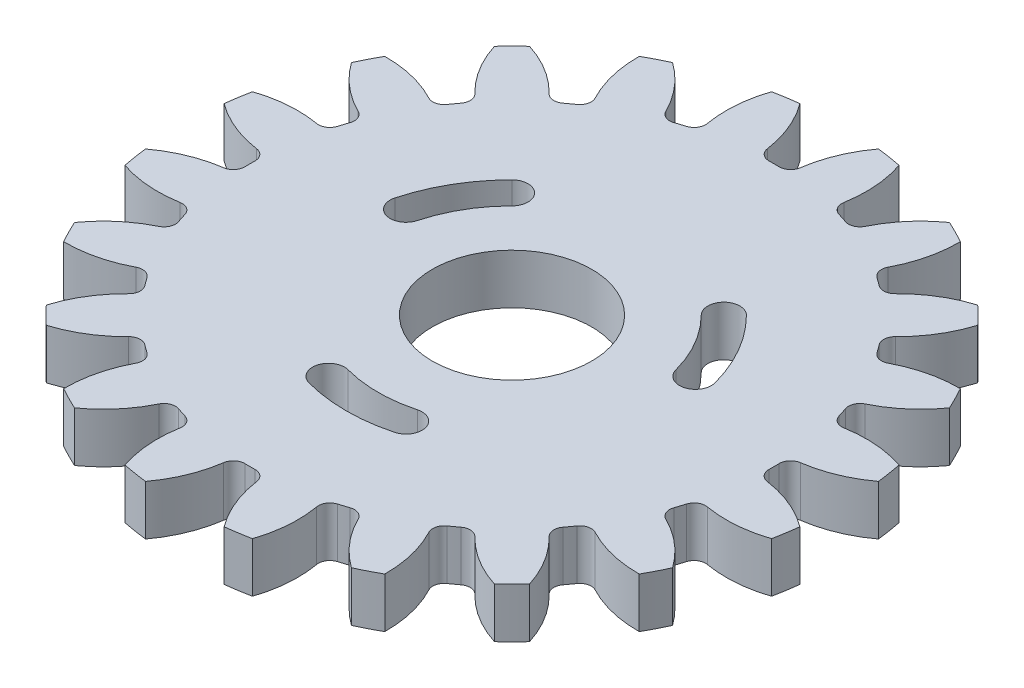
from build123d import *

# Parameters (mm, degrees)
SKETCH2_R                = 33
SKETCH2_R_2              = 7.975
BOSS_EXTRUDE1_DEPTH      = 5
CUT_EXTRUDE1_DEPTH       = 47.936126811
FILLET1_R                = 1.14
CIRPATTERN1_COUNT        = 20
FILLET1_OF_CIRPATTERN1_R = 1.14
CUT_EXTRUDE2_DEPTH       = 47.605335236


with BuildPart() as part:
    # Sketch2 → Boss-Extrude1 (new body)
    with BuildSketch(Plane(origin=(0, 0, 0), x_dir=(1, 0, 0), z_dir=(0, 1, 0))):
        Circle(SKETCH2_R)
        Circle(SKETCH2_R_2, mode=Mode.SUBTRACT)
    extrude(amount=BOSS_EXTRUDE1_DEPTH)

    # Sketch3 → Cut-Extrude1 (cut, through all)
    with BuildSketch(Plane(origin=(0, 5, 0), x_dir=(1, 0, 0), z_dir=(0, 1, 0))):
        with BuildLine():
            ThreePointArc((1.54561618, 26.204457076), (0, 26.25), (-1.54561618, 26.204457076))
            ThreePointArc((-1.54561618, 26.204457076), (-2.260255479, 29.659029471), (-3.933366347, 32.764746744))
            ThreePointArc((-3.933366347, 32.764746744), (0, 33), (3.933366347, 32.764746744))
            ThreePointArc((3.933366347, 32.764746744), (2.260255479, 29.659029471), (1.54561618, 26.204457076))
        make_face()
    cut_extrude1 = extrude(amount=-CUT_EXTRUDE1_DEPTH, mode=Mode.SUBTRACT)

    # Fillet1
    fillet1_edges = [part.edges().sort_by_distance(p)[0] for p in [
        (1.54561618, 2.5, -26.204457076),
        (-1.54561618, 2.5, -26.204457076),
    ]]
    fillet(fillet1_edges, radius=FILLET1_R)

    # CirPattern1: Cut-Extrude1 ×20 about axis
    cirpattern1_axis = Axis((0, 5, 0), (0, -1, 0))
    for i in range(1, CIRPATTERN1_COUNT):
        add(cut_extrude1.rotate(cirpattern1_axis, i * 360 / CIRPATTERN1_COUNT), mode=Mode.SUBTRACT)

    # Fillet1 of CirPattern1
    fillet1_of_cirpattern1_edges = [part.edges().sort_by_distance(p)[0] for p in [
        (9.567590904, 2.5, -24.444297991),
        (6.627654225, 2.5, -25.399541324),
        (16.65302317, 2.5, -20.291360706),
        (14.152163657, 2.5, -22.108341499),
        (22.108341499, 2.5, -14.152163657),
        (20.291360706, 2.5, -16.65302317),
        (25.399541324, 2.5, -6.627654225),
        (24.444297991, 2.5, -9.567590904),
        (26.204457076, 2.5, 1.54561618),
        (26.204457076, 2.5, -1.54561618),
        (24.444297991, 2.5, 9.567590904),
        (25.399541324, 2.5, 6.627654225),
        (20.291360706, 2.5, 16.65302317),
        (22.108341499, 2.5, 14.152163657),
        (14.152163657, 2.5, 22.108341499),
        (16.65302317, 2.5, 20.291360706),
        (6.627654225, 2.5, 25.399541324),
        (9.567590904, 2.5, 24.444297991),
        (-1.54561618, 2.5, 26.204457076),
        (1.54561618, 2.5, 26.204457076),
        (-9.567590904, 2.5, 24.444297991),
        (-6.627654225, 2.5, 25.399541324),
        (-16.65302317, 2.5, 20.291360706),
        (-14.152163657, 2.5, 22.108341499),
        (-22.108341499, 2.5, 14.152163657),
        (-20.291360706, 2.5, 16.65302317),
        (-25.399541324, 2.5, 6.627654225),
        (-24.444297991, 2.5, 9.567590904),
        (-26.204457076, 2.5, -1.54561618),
        (-26.204457076, 2.5, 1.54561618),
        (-24.444297991, 2.5, -9.567590904),
        (-25.399541324, 2.5, -6.627654225),
        (-20.291360706, 2.5, -16.65302317),
        (-22.108341499, 2.5, -14.152163657),
        (-14.152163657, 2.5, -22.108341499),
        (-16.65302317, 2.5, -20.291360706),
        (-6.627654225, 2.5, -25.399541324),
        (-9.567590904, 2.5, -24.444297991),
    ]]
    fillet(fillet1_of_cirpattern1_edges, radius=FILLET1_OF_CIRPATTERN1_R)

    # Sketch4 → Cut-Extrude2 (cut, through all)
    with BuildSketch(Plane.XZ):
        with BuildLine():
            ThreePointArc((4.296396149, 16.034368716), (0, 16.6), (-4.296396149, 16.034368716))
            ThreePointArc((-4.296396149, 16.034368716), (-5.427766999, 14.074776922), (-3.468175204, 12.943406072))
            ThreePointArc((-3.468175204, 12.943406072), (0, 13.4), (3.468175204, 12.943406072))
            ThreePointArc((3.468175204, 12.943406072), (5.427766999, 14.074776922), (4.296396149, 16.034368716))
        make_face()
        with BuildLine():
            ThreePointArc((11.737972568, -11.737972568), (14.376021703, -8.3), (16.034368716, -4.296396149))
            ThreePointArc((16.034368716, -4.296396149), (14.902997867, -2.336804354), (12.943406072, -3.468175204))
            ThreePointArc((12.943406072, -3.468175204), (11.604740411, -6.7), (9.475230868, -9.475230868))
            ThreePointArc((9.475230868, -9.475230868), (9.475230868, -11.737972568), (11.737972568, -11.737972568))
        make_face()
        with BuildLine():
            ThreePointArc((-16.034368716, -4.296396149), (-14.376021703, -8.3), (-11.737972568, -11.737972568))
            ThreePointArc((-11.737972568, -11.737972568), (-9.475230868, -11.737972568), (-9.475230868, -9.475230868))
            ThreePointArc((-9.475230868, -9.475230868), (-11.604740411, -6.7), (-12.943406072, -3.468175204))
            ThreePointArc((-12.943406072, -3.468175204), (-14.902997867, -2.336804354), (-16.034368716, -4.296396149))
        make_face()
    extrude(amount=-CUT_EXTRUDE2_DEPTH, mode=Mode.SUBTRACT)


solid = part.part
